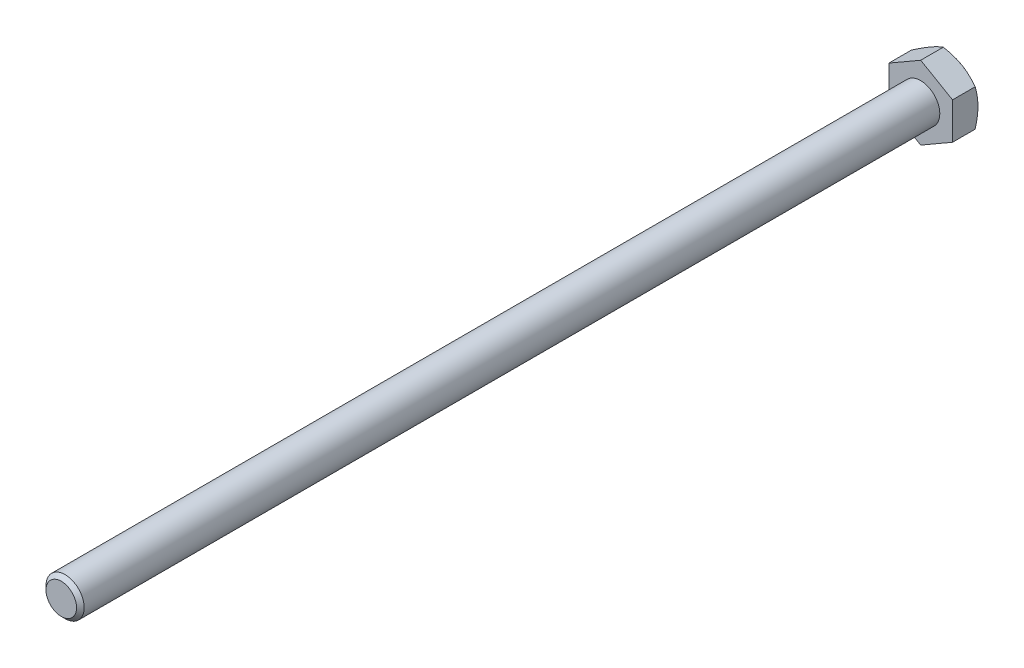
from build123d import *

# Parameters (mm, degrees)
ESQUISSE1_W        = 3
ESQUISSE1_H        = 135
BOSS_EXTRU_1_DEPTH = 4


with BuildPart() as part:
    # Esquisse1 → Base-Révolution (revolve)
    with BuildSketch(Plane(origin=(0, 0, 0), x_dir=(1, 0, 0), z_dir=(0, 1, 0))):
        with Locations((1.5, -67.5)):
            Rectangle(ESQUISSE1_W, ESQUISSE1_H)
    revolve(axis=Axis((0, 0, 0), (0, 0, 1)))

    # Chanfrein1: read off the stored shape, not the designer's step
    # Chanfrein1 outline → Chanfrein1 (revolve, cut)
    with BuildSketch(Plane.XZ):
        Polygon((3, 135), (2.4, 135), (3, 134.4), align=None)
    revolve(axis=Axis((0, 0, 0), (0, 0, 1)), mode=Mode.SUBTRACT)

    # Esquisse6 → Boss.-Extru.1 (add)
    with BuildSketch(Plane.XY):
        Polygon((5, -2.886751346), (5, 2.886751346), (0, 5.773502692), (-5, 2.886751346), (-5, -2.886751346), (0, -5.773502692), align=None)
    extrude(amount=-BOSS_EXTRU_1_DEPTH)

    # Esquisse7 → Enlèvement de matière-Révolution1 (revolve, cut)
    with BuildSketch(Plane(origin=(0, 0, 0), x_dir=(1, 0, 0), z_dir=(0, 1, 0))):
        Polygon((-5, 4), (-11.92820323, 4), (-11.92820323, 0), align=None)
    revolve(axis=Axis((0, 0, -6.239446496), (0, 0, 1)), mode=Mode.SUBTRACT)


solid = part.part
